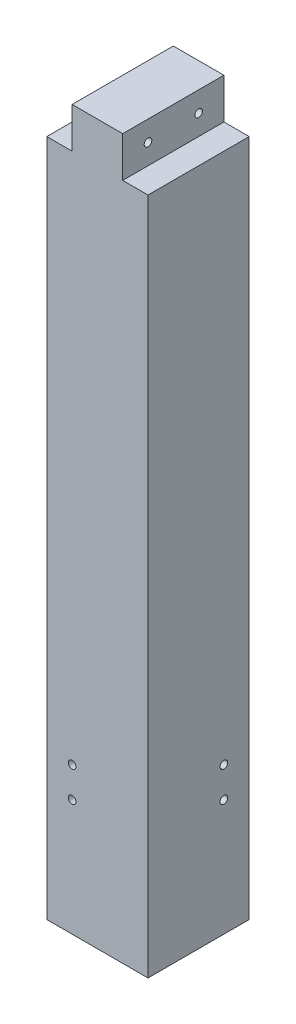
from build123d import *

# Parameters (mm, degrees)
BOSS_EXTRUDE1_DEPTH = 127
SKETCH4_W           = 31.75
SKETCH4_H           = 76.2
CUT_EXTRUDE3_DEPTH  = 63.5
SKETCH5_W           = 31.75
SKETCH5_H           = 76.2
CUT_EXTRUDE4_DEPTH  = 63.246
SKETCH7_R           = 4.7625
CUT_EXTRUDE6_DEPTH  = 69.85
SKETCH8_R           = 4.7625
CUT_EXTRUDE8_DEPTH  = 69.85
SKETCH9_R           = 4.7625
CUT_EXTRUDE9_DEPTH  = 503.011578552


with BuildPart() as part:
    # Sketch1 → Boss-Extrude1 (new body)
    with BuildSketch(Plane.XY):
        Polygon((63.5, -425.45), (63.5, 425.45), (31.75, 425.45), (31.75, 476.25), (-31.75, 476.25), (-31.75, 425.45), (-63.5, 425.45), (-63.5, -425.45), align=None)
    extrude(amount=-BOSS_EXTRUDE1_DEPTH)

    # Sketch4 → Cut-Extrude3 (cut)
    with BuildSketch(Plane.ZY.offset(63.5)):
        with Locations((-47.625, -260.35)):
            Rectangle(SKETCH4_W, SKETCH4_H)
    extrude(amount=-CUT_EXTRUDE3_DEPTH, mode=Mode.SUBTRACT)

    # Sketch5 → Cut-Extrude4 (cut)
    with BuildSketch(Plane(origin=(0, 0, -127), x_dir=(-1, 0, 0), z_dir=(0, 0, -1))):
        with Locations((-15.875, -260.35)):
            Rectangle(SKETCH5_W, SKETCH5_H)
    extrude(amount=-CUT_EXTRUDE4_DEPTH, mode=Mode.SUBTRACT)

    # Sketch7 → Cut-Extrude6 (cut)
    with BuildSketch(Plane(origin=(63.5, 0, 0), x_dir=(0, 0, -1), z_dir=(1, 0, 0))):
        with Locations((95.25, -241.3)):
            Circle(SKETCH7_R)
        with Locations((95.25, -279.4)):
            Circle(SKETCH7_R)
    extrude(amount=-CUT_EXTRUDE6_DEPTH, mode=Mode.SUBTRACT)

    # Sketch8 → Cut-Extrude8 (cut)
    with BuildSketch(Plane.XY):
        with Locations((-31.75, -241.3)):
            Circle(SKETCH8_R)
        with Locations((-31.75, -279.4)):
            Circle(SKETCH8_R)
    extrude(amount=-CUT_EXTRUDE8_DEPTH, mode=Mode.SUBTRACT)

    # Sketch9 → Cut-Extrude9 (cut, through all)
    with BuildSketch(Plane.ZY.offset(31.75)):
        with Locations((-95.25, 450.85)):
            Circle(SKETCH9_R)
        with Locations((-31.75, 450.85)):
            Circle(SKETCH9_R)
    extrude(amount=-CUT_EXTRUDE9_DEPTH, mode=Mode.SUBTRACT)


solid = part.part
